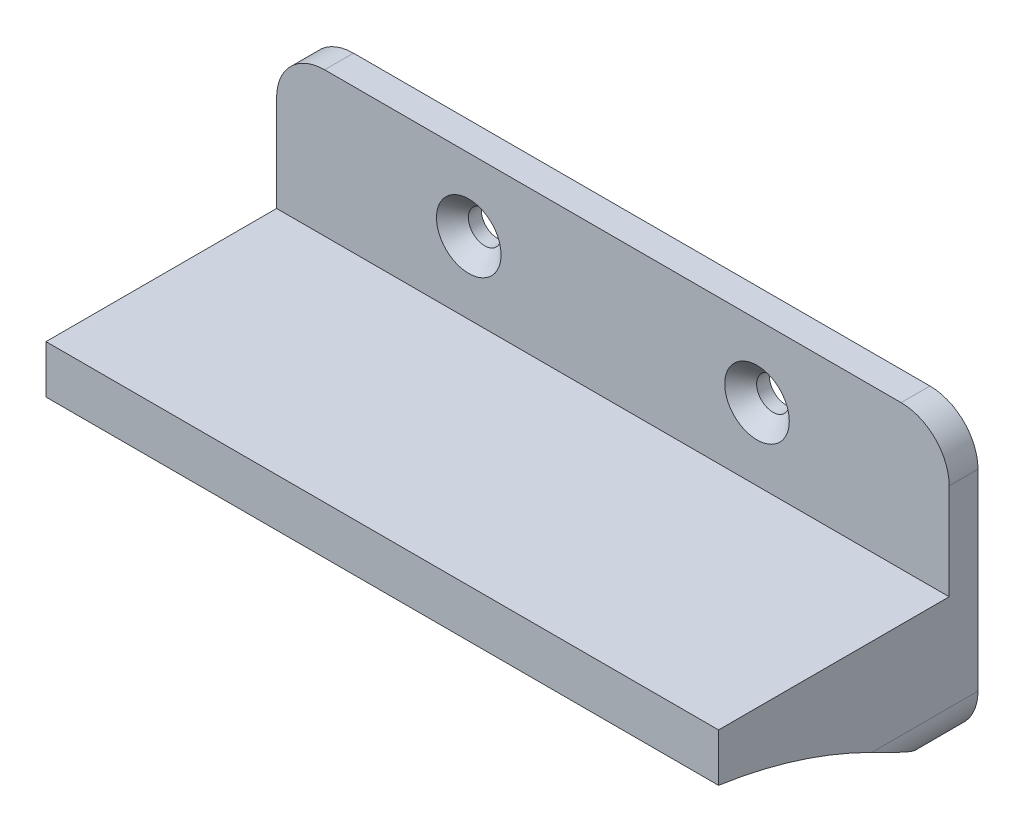
from build123d import *

# Parameters (mm, degrees)
CROQUIS1_W                                   = 70
CROQUIS1_H                                   = 30
SALIENTE_EXTRUIR1_DEPTH                      = 3
SALIENTE_EXTRUIR2_DEPTH                      = 24
CORTAR_EXTRUIR1_DEPTH                        = 70.000004
CROQUIS5_R                                   = 1.5
CORTAR_EXTRUIR2_DEPTH                        = 3
REFRENTADO_PARA_TORNILLO_TAP_N_CON_C_2_COUNT = 2
REFRENTADO_PARA_TORNILLO_TAP_N_CON_C_2_PITCH = 30
REFRENTADO_PARA_TORNILLO_TAP_N_CON_C_3_COUNT = 2
REFRENTADO_PARA_TORNILLO_TAP_N_CON_C_3_PITCH = 18.848076825
REFRENTADO_PARA_TORNILLO_TAP_N_CON_C_4_COUNT = 2
REFRENTADO_PARA_TORNILLO_TAP_N_CON_C_4_PITCH = 40.929817982
REDONDEO1_R                                  = 5


with BuildPart() as part:
    # Croquis1 → Saliente-Extruir1 (new body)
    with BuildSketch(Plane.XY):
        with Locations((5.076335878, 0.496183206)):
            Rectangle(CROQUIS1_W, CROQUIS1_H)
    extrude(amount=SALIENTE_EXTRUIR1_DEPTH)

    # Croquis3 → Saliente-Extruir2 (add)
    with BuildSketch(Plane.XY.offset(3)):
        Polygon((-29.923664122, 0.496183206), (40.076335878, 0.496183206), (40.076335878, -4.503816794), (40.076335878, -14.503816794), (36.076335878, -14.503816794), (36.076335878, -4.503816794), (18.076335878, -4.503816794), (18.076335878, -14.503816794), (14.076335878, -14.503816794), (14.076335878, -4.503816794), (-3.923664122, -4.503816794), (-3.923664122, -14.503816794), (-7.923664122, -14.503816794), (-7.923664122, -4.503816794), (-25.923664122, -4.503816794), (-25.923664122, -14.503816794), (-29.923664122, -14.503816794), (-29.923664122, -4.503816794), align=None)
    extrude(amount=SALIENTE_EXTRUIR2_DEPTH)

    # Croquis4 → Cortar-Extruir1 (cut)
    with BuildSketch(Plane.ZY.offset(29.923664122)):
        with BuildLine():
            Line((27, -14.503816794), (27, -4.503816794))
            ThreePointArc((27, -4.503816794), (14.366976751, -7.984560996), (3, -14.503816794))
            Line((3, -14.503816794), (27, -14.503816794))
        make_face()
    extrude(amount=-CORTAR_EXTRUIR1_DEPTH, mode=Mode.SUBTRACT)

    # Croquis5 → Cortar-Extruir2 (cut)
    with BuildSketch(Plane.XY.offset(3)):
        with Locations((-9.923664122, 7.996183206)):
            Circle(CROQUIS5_R)
        with Locations(Location((20.076335878, 7.996183206, 0), (0, 0, 180))):
            Circle(CROQUIS5_R)
        with Locations((-16.923664122, -9.503816794)):
            Circle(CROQUIS5_R)
        with Locations(Location((27.076335878, -9.503816794, 0), (0, 0, 180))):
            Circle(CROQUIS5_R)
    extrude(amount=-CORTAR_EXTRUIR2_DEPTH, mode=Mode.SUBTRACT)

    # Croquis7 → Refrentado para tornillo tapón con cabeza plana de clavija de M31 (revolve, cut)
    with BuildSketch(Plane(origin=(-9.923664122, 7.996183206, 3), x_dir=(0, -1, 0), z_dir=(1, 0, 0))):
        Polygon((0, 0), (0, 3), (1.7, 3), (1.7, 1.66), (3.36, 0), align=None)
    refrentado_para_tornillo_tap_n_con_cabez = revolve(axis=Axis((-9.923664122, 7.996183206, 9.35), (0, 0, -1)), mode=Mode.SUBTRACT)

    # Refrentado para tornillo tap_n con c 2: Refrentado para tornillo tapón con cabeza plana de clavija de M31 ×2
    with Locations(*[(i * REFRENTADO_PARA_TORNILLO_TAP_N_CON_C_2_PITCH, 0, 0) for i in range(1, REFRENTADO_PARA_TORNILLO_TAP_N_CON_C_2_COUNT)]):
        add(refrentado_para_tornillo_tap_n_con_cabez, mode=Mode.SUBTRACT)

    # Refrentado para tornillo tap_n con c 3: Refrentado para tornillo tapón con cabeza plana de clavija de M31 ×2
    with Locations(*[Vector(-0.3713906763541037, -0.9284766908852593, 0) * (i * REFRENTADO_PARA_TORNILLO_TAP_N_CON_C_3_PITCH) for i in range(1, REFRENTADO_PARA_TORNILLO_TAP_N_CON_C_3_COUNT)]):
        add(refrentado_para_tornillo_tap_n_con_cabez, mode=Mode.SUBTRACT)

    # Refrentado para tornillo tap_n con c 4: Refrentado para tornillo tapón con cabeza plana de clavija de M31 ×2
    with Locations(*[Vector(0.9039864290798859, -0.42756114888913443, 0) * (i * REFRENTADO_PARA_TORNILLO_TAP_N_CON_C_4_PITCH) for i in range(1, REFRENTADO_PARA_TORNILLO_TAP_N_CON_C_4_COUNT)]):
        add(refrentado_para_tornillo_tap_n_con_cabez, mode=Mode.SUBTRACT)

    # Redondeo1
    # the kernel refuses this fillet: 5 mm, written as the material it takes off along each edge
    with BuildSketch(Plane(origin=(40.076335878, -14.503816794, 15.5), x_dir=(0, 1, 0), z_dir=(0, 0, -1)), Plane(origin=(-29.923664122, -14.503816794, -12.5), x_dir=(0, 1, 0), z_dir=(0, 0, 1)), Plane(origin=(-29.923664122, 15.496183206, -12.5), x_dir=(1, 0, 0), z_dir=(0, 0, 1))) as redondeo1_piece_1:
        with BuildLine():
            CenterArc((REDONDEO1_R, -REDONDEO1_R), REDONDEO1_R, 90, 90)
            Line((0, -REDONDEO1_R), (0, 0))
            Line((0, 0), (REDONDEO1_R, 0))
        make_face()
    extrude(amount=28, mode=Mode.SUBTRACT)
    with BuildSketch(Plane(origin=(40.076335878, 15.496183206, -12.5), x_dir=(-1, 0, 0), z_dir=(0, 0, 1))) as redondeo1_piece_2:
        with BuildLine():
            CenterArc((REDONDEO1_R, REDONDEO1_R), REDONDEO1_R, 180, 90)
            Line((0, REDONDEO1_R), (0, 0))
            Line((0, 0), (REDONDEO1_R, 0))
        make_face()
    extrude(amount=28, mode=Mode.SUBTRACT)


solid = part.part
